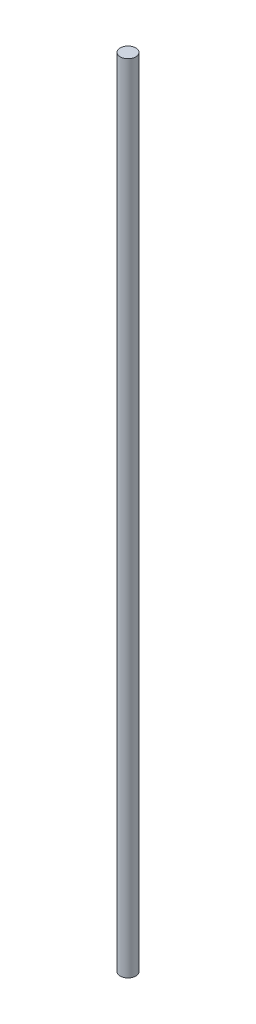
from build123d import *

# Parameters (mm, degrees)
SKETCH_1_R      = 3
EXTRUDE_1_DEPTH = 307


with BuildPart() as part:
    # Эскиз1 → Вытянуть1 (new body)
    with BuildSketch(Plane(origin=(0, 0, 0), x_dir=(1, 0, 0), z_dir=(0, 1, 0))):
        Circle(SKETCH_1_R)
    extrude(amount=EXTRUDE_1_DEPTH)


solid = part.part
